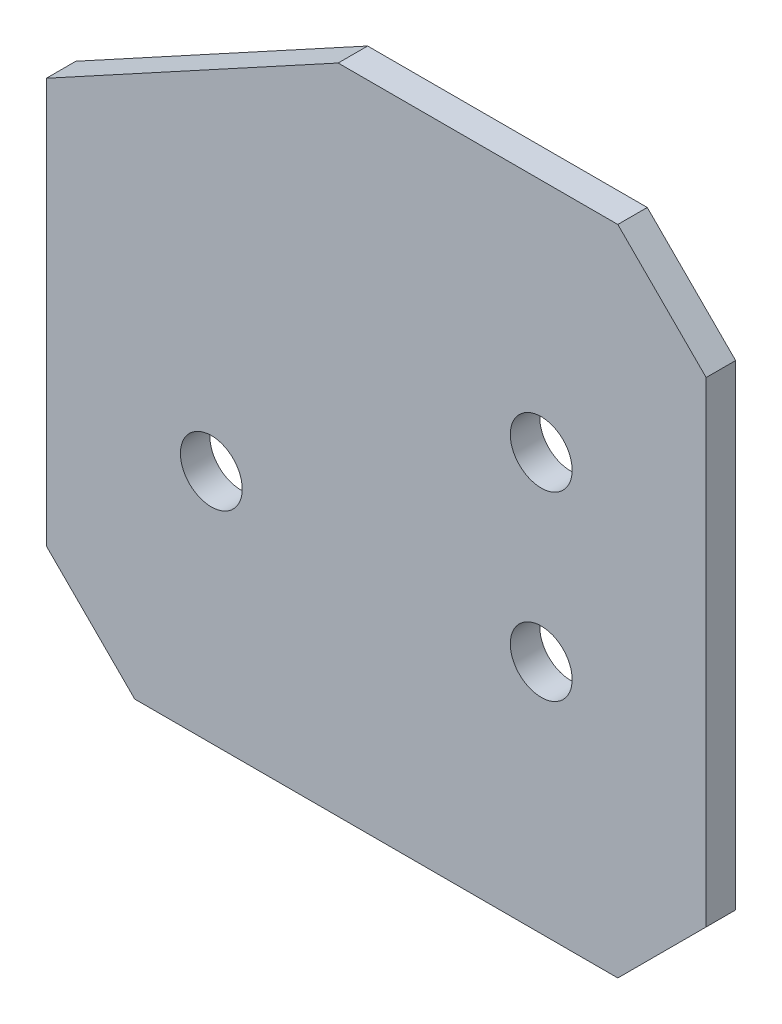
from build123d import *

# Parameters (mm, degrees)
SKETCH_1_W             = 112
SKETCH_1_H             = 110.77381068
SKETCH_1_R             = 5.25
SM_BASE_FLANGE_1_DEPTH = 5
CHAMFER_1_SIZE         = 15
CUT_EXTRUDE_1_DEPTH    = 10


# Sheet-metal steps are written as plain solids
with BuildPart() as part:
    # Sketch 1 → Базовая кромка1 (new body)
    with BuildSketch(Plane.XY):
        with Locations((0, 58.38690534)):
            Rectangle(SKETCH_1_W, SKETCH_1_H)
        with Locations((-28, 43)):
            Circle(SKETCH_1_R, mode=Mode.SUBTRACT)
        with Locations(Location((28, 73.77381068, 0), (0, 0, 180))):
            Circle(SKETCH_1_R, mode=Mode.SUBTRACT)
        with Locations(Location((28, 43, 0), (0, 0, 180))):
            Circle(SKETCH_1_R, mode=Mode.SUBTRACT)
    extrude(amount=-SM_BASE_FLANGE_1_DEPTH)

    # Фаска1
    chamfer_1_edges = [part.edges().sort_by_distance(p)[0] for p in [
        (56, 3, -2.5),
        (-56, 3, -2.5),
        (-56, 113.77381068, -2.5),
        (56, 113.77381068, -2.5),
    ]]
    chamfer(chamfer_1_edges, length=CHAMFER_1_SIZE)

    # Sketch 2 → Вырез-Вытянуть1 (cut)
    with BuildSketch(Plane.XY):
        Polygon((-56, 113.77381068), (-56, 86.768448621), (-6.468509112, 113.77381068), align=None)
    extrude(amount=-CUT_EXTRUDE_1_DEPTH, mode=Mode.SUBTRACT)


solid = part.part
